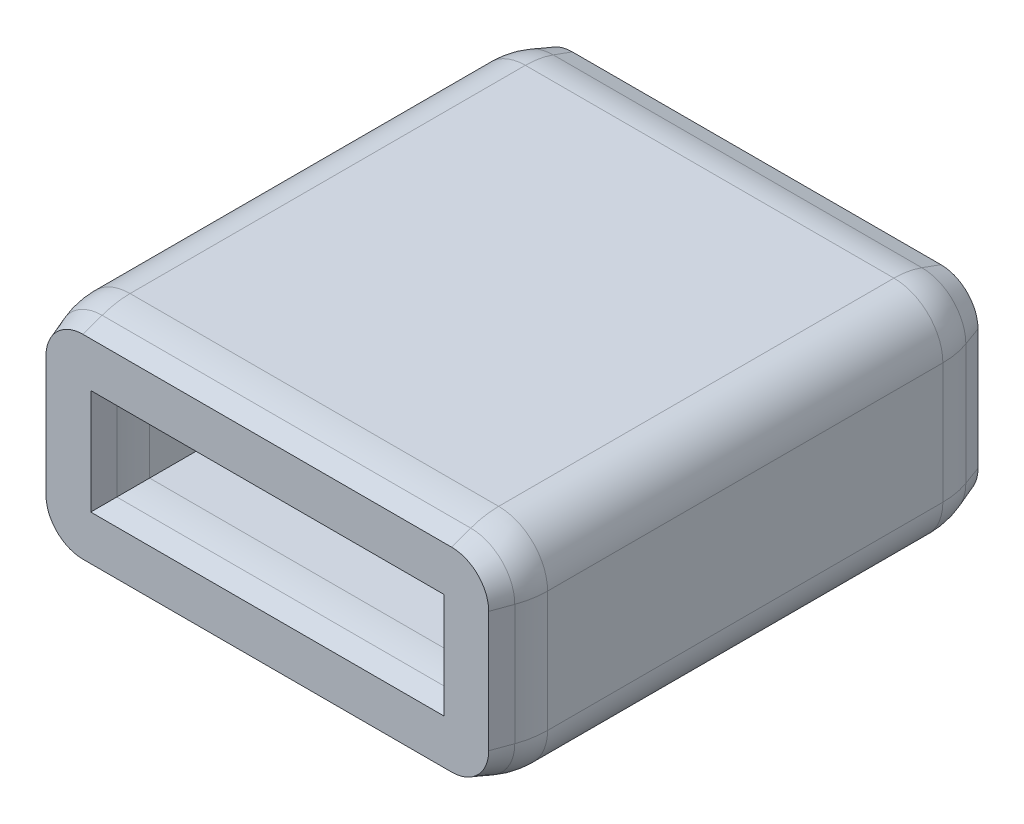
from build123d import *
from OCP.BRepFilletAPI import BRepFilletAPI_MakeChamfer

# Parameters (mm, degrees)
PROFILE_SKETCH_W         = 14.3
PROFILE_SKETCH_H         = 6.7
PROFILE_SKETCH_W_2       = 10.1
PROFILE_SKETCH_H_2       = 2.5
PROFILE_EXTRUDE_DEPTH    = 15
OUTSIDE_CORNER_FILLETS_R = 1.5
END_1_CHAMFER_SIZE       = 1
END_1_CHAMFER_SIZE2      = 0.363970234
END_2_CHAMFER_SIZE       = 1
END_2_CHAMFER_SIZE2      = 0.363970234
TRANSITION_FILLETS_R     = 2.5


with BuildPart() as part:
    # Profile Sketch → Profile Extrude (new body)
    with BuildSketch(Plane.XY):
        Rectangle(PROFILE_SKETCH_W, PROFILE_SKETCH_H)
        Rectangle(PROFILE_SKETCH_W_2, PROFILE_SKETCH_H_2, mode=Mode.SUBTRACT)
    extrude(amount=PROFILE_EXTRUDE_DEPTH)

    # Outside Corner Fillets
    outside_corner_fillets_edges = [part.edges().sort_by_distance(p)[0] for p in [
        (7.15, 3.35, 7.5),
        (7.15, -3.35, 7.5),
        (-7.15, 3.35, 7.5),
        (-7.15, -3.35, 7.5),
    ]]
    fillet(outside_corner_fillets_edges, radius=OUTSIDE_CORNER_FILLETS_R)

    # End 1 Chamfer: one chamfer whose edges measure the first distance from different faces: ONE call of the kernel's chamfer builder (chamfer() names one face for all edges)
    end_1_chamfer_edges_1 = [part.edges().sort_by_distance(p)[0] for p in [
        (6.710660172, 2.910660172, 0),
    ]]
    end_1_chamfer_side_1 = [part.faces().sort_by_distance(p)[0] for p in [
        (6.710660172, 2.910660172, 7.5),
    ]]
    end_1_chamfer_edges_2 = [part.edges().sort_by_distance(p)[0] for p in [
        (7.15, 0, 0),
    ]]
    end_1_chamfer_side_2 = [part.faces().sort_by_distance(p)[0] for p in [
        (7.15, 0, 7.5),
    ]]
    end_1_chamfer_edges_3 = [part.edges().sort_by_distance(p)[0] for p in [
        (6.710660172, -2.910660172, 0),
    ]]
    end_1_chamfer_side_3 = [part.faces().sort_by_distance(p)[0] for p in [
        (6.710660172, -2.910660172, 7.5),
    ]]
    end_1_chamfer_edges_4 = [part.edges().sort_by_distance(p)[0] for p in [
        (0, -3.35, 0),
    ]]
    end_1_chamfer_side_4 = [part.faces().sort_by_distance(p)[0] for p in [
        (0, -3.35, 7.5),
    ]]
    end_1_chamfer_edges_5 = [part.edges().sort_by_distance(p)[0] for p in [
        (-6.710660172, -2.910660172, 0),
    ]]
    end_1_chamfer_side_5 = [part.faces().sort_by_distance(p)[0] for p in [
        (-6.710660172, -2.910660172, 7.5),
    ]]
    end_1_chamfer_edges_6 = [part.edges().sort_by_distance(p)[0] for p in [
        (-7.15, 0, 0),
    ]]
    end_1_chamfer_side_6 = [part.faces().sort_by_distance(p)[0] for p in [
        (-7.15, 0, 7.5),
    ]]
    end_1_chamfer_edges_7 = [part.edges().sort_by_distance(p)[0] for p in [
        (-6.710660172, 2.910660172, 0),
    ]]
    end_1_chamfer_side_7 = [part.faces().sort_by_distance(p)[0] for p in [
        (-6.710660172, 2.910660172, 7.5),
    ]]
    end_1_chamfer_edges_8 = [part.edges().sort_by_distance(p)[0] for p in [
        (0, 3.35, 0),
    ]]
    end_1_chamfer_side_8 = [part.faces().sort_by_distance(p)[0] for p in [
        (0, 3.35, 7.5),
    ]]
    end_1_chamfer_edges_9 = [part.edges().sort_by_distance(p)[0] for p in [
        (5.05, 0, 15),
    ]]
    end_1_chamfer_side_9 = [part.faces().sort_by_distance(p)[0] for p in [
        (5.05, 0, 7.5),
    ]]
    end_1_chamfer_edges_10 = [part.edges().sort_by_distance(p)[0] for p in [
        (0, 1.25, 15),
    ]]
    end_1_chamfer_side_10 = [part.faces().sort_by_distance(p)[0] for p in [
        (0, 1.25, 7.5),
    ]]
    end_1_chamfer_edges_11 = [part.edges().sort_by_distance(p)[0] for p in [
        (-5.05, 0, 15),
    ]]
    end_1_chamfer_side_11 = [part.faces().sort_by_distance(p)[0] for p in [
        (-5.05, 0, 7.5),
    ]]
    end_1_chamfer_edges_12 = [part.edges().sort_by_distance(p)[0] for p in [
        (0, -1.25, 15),
    ]]
    end_1_chamfer_side_12 = [part.faces().sort_by_distance(p)[0] for p in [
        (0, -1.25, 7.5),
    ]]
    end_1_chamfer = BRepFilletAPI_MakeChamfer(part.part.solid().wrapped)
    for e in end_1_chamfer_edges_1:
        end_1_chamfer.Add(END_1_CHAMFER_SIZE, END_1_CHAMFER_SIZE2, e.wrapped, end_1_chamfer_side_1[0].wrapped)  # the first distance lies on this face
    for e in end_1_chamfer_edges_2:
        end_1_chamfer.Add(END_1_CHAMFER_SIZE, END_1_CHAMFER_SIZE2, e.wrapped, end_1_chamfer_side_2[0].wrapped)  # the first distance lies on this face
    for e in end_1_chamfer_edges_3:
        end_1_chamfer.Add(END_1_CHAMFER_SIZE, END_1_CHAMFER_SIZE2, e.wrapped, end_1_chamfer_side_3[0].wrapped)  # the first distance lies on this face
    for e in end_1_chamfer_edges_4:
        end_1_chamfer.Add(END_1_CHAMFER_SIZE, END_1_CHAMFER_SIZE2, e.wrapped, end_1_chamfer_side_4[0].wrapped)  # the first distance lies on this face
    for e in end_1_chamfer_edges_5:
        end_1_chamfer.Add(END_1_CHAMFER_SIZE, END_1_CHAMFER_SIZE2, e.wrapped, end_1_chamfer_side_5[0].wrapped)  # the first distance lies on this face
    for e in end_1_chamfer_edges_6:
        end_1_chamfer.Add(END_1_CHAMFER_SIZE, END_1_CHAMFER_SIZE2, e.wrapped, end_1_chamfer_side_6[0].wrapped)  # the first distance lies on this face
    for e in end_1_chamfer_edges_7:
        end_1_chamfer.Add(END_1_CHAMFER_SIZE, END_1_CHAMFER_SIZE2, e.wrapped, end_1_chamfer_side_7[0].wrapped)  # the first distance lies on this face
    for e in end_1_chamfer_edges_8:
        end_1_chamfer.Add(END_1_CHAMFER_SIZE, END_1_CHAMFER_SIZE2, e.wrapped, end_1_chamfer_side_8[0].wrapped)  # the first distance lies on this face
    for e in end_1_chamfer_edges_9:
        end_1_chamfer.Add(END_1_CHAMFER_SIZE, END_1_CHAMFER_SIZE2, e.wrapped, end_1_chamfer_side_9[0].wrapped)  # the first distance lies on this face
    for e in end_1_chamfer_edges_10:
        end_1_chamfer.Add(END_1_CHAMFER_SIZE, END_1_CHAMFER_SIZE2, e.wrapped, end_1_chamfer_side_10[0].wrapped)  # the first distance lies on this face
    for e in end_1_chamfer_edges_11:
        end_1_chamfer.Add(END_1_CHAMFER_SIZE, END_1_CHAMFER_SIZE2, e.wrapped, end_1_chamfer_side_11[0].wrapped)  # the first distance lies on this face
    for e in end_1_chamfer_edges_12:
        end_1_chamfer.Add(END_1_CHAMFER_SIZE, END_1_CHAMFER_SIZE2, e.wrapped, end_1_chamfer_side_12[0].wrapped)  # the first distance lies on this face
    add(Compound.cast(end_1_chamfer.Shape()), mode=Mode.REPLACE)

    # End 2 Chamfer: one chamfer whose edges measure the first distance from different faces: ONE call of the kernel's chamfer builder (chamfer() names one face for all edges)
    end_2_chamfer_edges_1 = [part.edges().sort_by_distance(p)[0] for p in [
        (0, -3.35, 15),
    ]]
    end_2_chamfer_side_1 = [part.faces().sort_by_distance(p)[0] for p in [
        (0, -3.35, 8),
    ]]
    end_2_chamfer_edges_2 = [part.edges().sort_by_distance(p)[0] for p in [
        (6.710660172, -2.910660172, 15),
    ]]
    end_2_chamfer_side_2 = [part.faces().sort_by_distance(p)[0] for p in [
        (6.710660172, -2.910660172, 8),
    ]]
    end_2_chamfer_edges_3 = [part.edges().sort_by_distance(p)[0] for p in [
        (-6.710660172, -2.910660172, 15),
    ]]
    end_2_chamfer_side_3 = [part.faces().sort_by_distance(p)[0] for p in [
        (-6.710660172, -2.910660172, 8),
    ]]
    end_2_chamfer_edges_4 = [part.edges().sort_by_distance(p)[0] for p in [
        (7.15, 0, 15),
    ]]
    end_2_chamfer_side_4 = [part.faces().sort_by_distance(p)[0] for p in [
        (7.15, 0, 8),
    ]]
    end_2_chamfer_edges_5 = [part.edges().sort_by_distance(p)[0] for p in [
        (-7.15, 0, 15),
    ]]
    end_2_chamfer_side_5 = [part.faces().sort_by_distance(p)[0] for p in [
        (-7.15, 0, 8),
    ]]
    end_2_chamfer_edges_6 = [part.edges().sort_by_distance(p)[0] for p in [
        (6.710660172, 2.910660172, 15),
    ]]
    end_2_chamfer_side_6 = [part.faces().sort_by_distance(p)[0] for p in [
        (6.710660172, 2.910660172, 8),
    ]]
    end_2_chamfer_edges_7 = [part.edges().sort_by_distance(p)[0] for p in [
        (-6.710660172, 2.910660172, 15),
    ]]
    end_2_chamfer_side_7 = [part.faces().sort_by_distance(p)[0] for p in [
        (-6.710660172, 2.910660172, 8),
    ]]
    end_2_chamfer_edges_8 = [part.edges().sort_by_distance(p)[0] for p in [
        (0, 3.35, 15),
    ]]
    end_2_chamfer_side_8 = [part.faces().sort_by_distance(p)[0] for p in [
        (0, 3.35, 8),
    ]]
    end_2_chamfer_edges_9 = [part.edges().sort_by_distance(p)[0] for p in [
        (5.05, 0, 0),
    ]]
    end_2_chamfer_side_9 = [part.faces().sort_by_distance(p)[0] for p in [
        (5.05, 0, 7),
    ]]
    end_2_chamfer_edges_10 = [part.edges().sort_by_distance(p)[0] for p in [
        (0, 1.25, 0),
    ]]
    end_2_chamfer_side_10 = [part.faces().sort_by_distance(p)[0] for p in [
        (0, 1.25, 7),
    ]]
    end_2_chamfer_edges_11 = [part.edges().sort_by_distance(p)[0] for p in [
        (-5.05, 0, 0),
    ]]
    end_2_chamfer_side_11 = [part.faces().sort_by_distance(p)[0] for p in [
        (-5.05, 0, 7),
    ]]
    end_2_chamfer_edges_12 = [part.edges().sort_by_distance(p)[0] for p in [
        (0, -1.25, 0),
    ]]
    end_2_chamfer_side_12 = [part.faces().sort_by_distance(p)[0] for p in [
        (0, -1.25, 7),
    ]]
    end_2_chamfer = BRepFilletAPI_MakeChamfer(part.part.solid().wrapped)
    for e in end_2_chamfer_edges_1:
        end_2_chamfer.Add(END_2_CHAMFER_SIZE, END_2_CHAMFER_SIZE2, e.wrapped, end_2_chamfer_side_1[0].wrapped)  # the first distance lies on this face
    for e in end_2_chamfer_edges_2:
        end_2_chamfer.Add(END_2_CHAMFER_SIZE, END_2_CHAMFER_SIZE2, e.wrapped, end_2_chamfer_side_2[0].wrapped)  # the first distance lies on this face
    for e in end_2_chamfer_edges_3:
        end_2_chamfer.Add(END_2_CHAMFER_SIZE, END_2_CHAMFER_SIZE2, e.wrapped, end_2_chamfer_side_3[0].wrapped)  # the first distance lies on this face
    for e in end_2_chamfer_edges_4:
        end_2_chamfer.Add(END_2_CHAMFER_SIZE, END_2_CHAMFER_SIZE2, e.wrapped, end_2_chamfer_side_4[0].wrapped)  # the first distance lies on this face
    for e in end_2_chamfer_edges_5:
        end_2_chamfer.Add(END_2_CHAMFER_SIZE, END_2_CHAMFER_SIZE2, e.wrapped, end_2_chamfer_side_5[0].wrapped)  # the first distance lies on this face
    for e in end_2_chamfer_edges_6:
        end_2_chamfer.Add(END_2_CHAMFER_SIZE, END_2_CHAMFER_SIZE2, e.wrapped, end_2_chamfer_side_6[0].wrapped)  # the first distance lies on this face
    for e in end_2_chamfer_edges_7:
        end_2_chamfer.Add(END_2_CHAMFER_SIZE, END_2_CHAMFER_SIZE2, e.wrapped, end_2_chamfer_side_7[0].wrapped)  # the first distance lies on this face
    for e in end_2_chamfer_edges_8:
        end_2_chamfer.Add(END_2_CHAMFER_SIZE, END_2_CHAMFER_SIZE2, e.wrapped, end_2_chamfer_side_8[0].wrapped)  # the first distance lies on this face
    for e in end_2_chamfer_edges_9:
        end_2_chamfer.Add(END_2_CHAMFER_SIZE, END_2_CHAMFER_SIZE2, e.wrapped, end_2_chamfer_side_9[0].wrapped)  # the first distance lies on this face
    for e in end_2_chamfer_edges_10:
        end_2_chamfer.Add(END_2_CHAMFER_SIZE, END_2_CHAMFER_SIZE2, e.wrapped, end_2_chamfer_side_10[0].wrapped)  # the first distance lies on this face
    for e in end_2_chamfer_edges_11:
        end_2_chamfer.Add(END_2_CHAMFER_SIZE, END_2_CHAMFER_SIZE2, e.wrapped, end_2_chamfer_side_11[0].wrapped)  # the first distance lies on this face
    for e in end_2_chamfer_edges_12:
        end_2_chamfer.Add(END_2_CHAMFER_SIZE, END_2_CHAMFER_SIZE2, e.wrapped, end_2_chamfer_side_12[0].wrapped)  # the first distance lies on this face
    add(Compound.cast(end_2_chamfer.Shape()), mode=Mode.REPLACE)

    # Transition Fillets
    transition_fillets_edges = [part.edges().sort_by_distance(p)[0] for p in [
        (6.710660172, 2.910660172, 1),
        (7.15, 0, 1),
        (6.710660172, -2.910660172, 1),
        (0, -3.35, 1),
        (-6.710660172, -2.910660172, 1),
        (-7.15, 0, 1),
        (-6.710660172, 2.910660172, 1),
        (0, 3.35, 1),
        (-6.710660172, 2.910660172, 14),
        (-7.15, 0, 14),
        (-6.710660172, -2.910660172, 14),
        (0, -3.35, 14),
        (6.710660172, -2.910660172, 14),
        (7.15, 0, 14),
        (6.710660172, 2.910660172, 14),
        (0, 3.35, 14),
        (0, 1.25, 1),
        (0, 1.25, 14),
        (5.05, 0, 14),
        (-5.05, 0, 14),
        (0, -1.25, 14),
        (-5.05, 0, 1),
        (0, -1.25, 1),
        (5.05, 0, 1),
    ]]
    fillet(transition_fillets_edges, radius=TRANSITION_FILLETS_R)


solid = part.part
